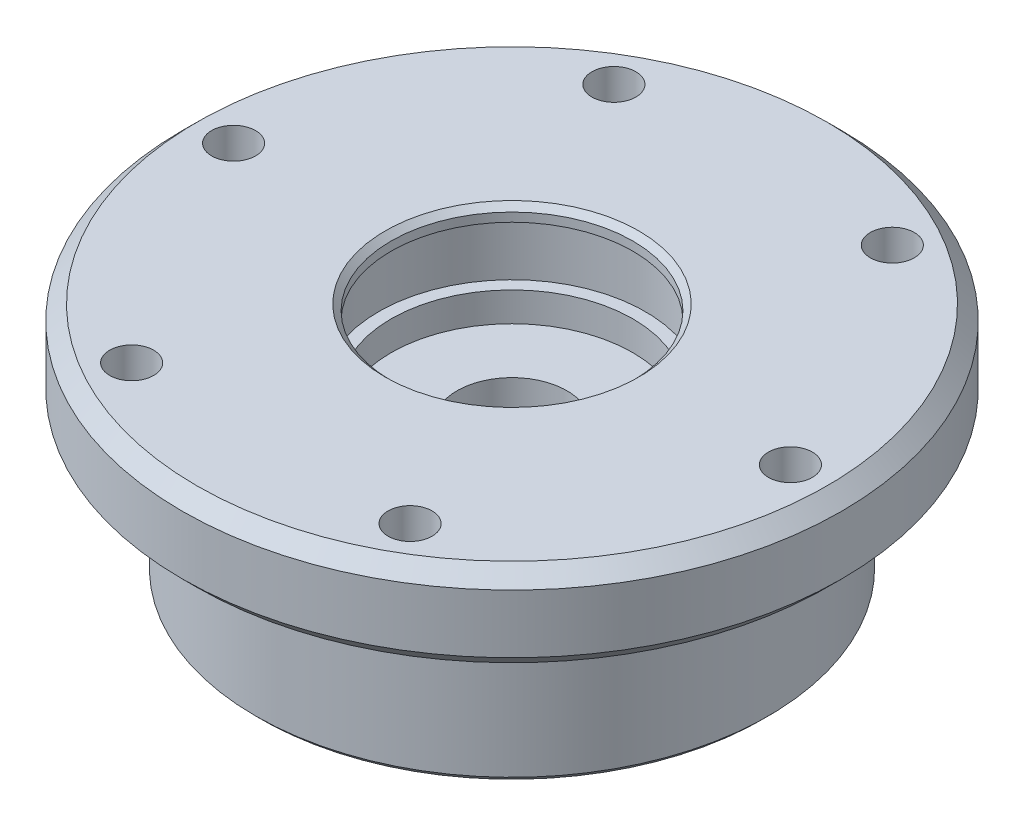
from build123d import *

# Parameters (mm, degrees)
SKETCH1_R           = 22.5
SKETCH1_R_2         = 1.5
SKETCH1_R_3         = 8.25
BOSS_EXTRUDE1_DEPTH = 3
SKETCH2_R           = 9.1
CUT_EXTRUDE1_DEPTH  = 2
SKETCH3_R           = 20.5
SKETCH3_R_2         = 17.5
BOSS_EXTRUDE2_DEPTH = 1
SKETCH4_R           = 17.5
SKETCH4_R_2         = 3.75
BOSS_EXTRUDE3_DEPTH = 10
SKETCH5_R           = 19
SKETCH5_R_2         = 17.5
BOSS_EXTRUDE4_DEPTH = 0.5
CHAMFER1_SIZE       = 1
CHAMFER3_SIZE       = 0.4
SKETCH6_R           = 2.35
CUT_EXTRUDE2_DEPTH  = 4
SKETCH7_R           = 1.75
CUT_EXTRUDE3_DEPTH  = 8
CHAMFER4_SIZE       = 0.4
CUT_EXTRUDE4_START  = -1
SKETCH8_R           = 8.25
CUT_EXTRUDE4_DEPTH  = 1


with BuildPart() as part:
    # Sketch1 → Boss-Extrude1 (new, symmetric)
    with BuildSketch(Plane(origin=(0, 0, 0), x_dir=(1, 0, 0), z_dir=(0, 1, 0))):
        Circle(SKETCH1_R)
        with Locations((19, 0)):
            Circle(SKETCH1_R_2, mode=Mode.SUBTRACT)
        with Locations((9.5, -16.454482672)):
            Circle(SKETCH1_R_2, mode=Mode.SUBTRACT)
        with Locations((-9.5, -16.454482672)):
            Circle(SKETCH1_R_2, mode=Mode.SUBTRACT)
        with Locations((-19, 0)):
            Circle(SKETCH1_R_2, mode=Mode.SUBTRACT)
        with Locations((-9.5, 16.454482672)):
            Circle(SKETCH1_R_2, mode=Mode.SUBTRACT)
        with Locations((9.5, 16.454482672)):
            Circle(SKETCH1_R_2, mode=Mode.SUBTRACT)
        Circle(SKETCH1_R_3, mode=Mode.SUBTRACT)
    extrude(amount=BOSS_EXTRUDE1_DEPTH, both=True)

    # Sketch2 → Cut-Extrude1 (cut, symmetric)
    with BuildSketch(Plane(origin=(0, 0, 0), x_dir=(1, 0, 0), z_dir=(0, 1, 0))):
        Circle(SKETCH2_R)
    extrude(amount=CUT_EXTRUDE1_DEPTH, both=True, mode=Mode.SUBTRACT)

    # Sketch3 → Boss-Extrude2 (add)
    with BuildSketch(Plane(origin=(0, -3, 0), x_dir=(1, 0, 0), z_dir=(0, 1, 0))):
        Circle(SKETCH3_R)
        Circle(SKETCH3_R_2, mode=Mode.SUBTRACT)
    extrude(amount=BOSS_EXTRUDE2_DEPTH)

    # Sketch4 → Boss-Extrude3 (add)
    with BuildSketch(Plane.XZ.offset(3)):
        Circle(SKETCH4_R)
        Circle(SKETCH4_R_2, mode=Mode.SUBTRACT)
    extrude(amount=BOSS_EXTRUDE3_DEPTH)

    # Sketch5 → Boss-Extrude4 (add)
    with BuildSketch(Plane.XZ.offset(3)):
        Circle(SKETCH5_R)
        Circle(SKETCH5_R_2, mode=Mode.SUBTRACT)
    extrude(amount=BOSS_EXTRUDE4_DEPTH)

    # Chamfer1
    chamfer1_edges = [part.edges().sort_by_distance(p)[0] for p in [
        (-22.5, -3, 0),
        (-22.5, 3, 0),
    ]]
    chamfer(chamfer1_edges, length=CHAMFER1_SIZE)

    # Chamfer3
    chamfer3_edges = [part.edges().sort_by_distance(p)[0] for p in [
        (-8.25, 3, 0),
    ]]
    chamfer(chamfer3_edges, length=CHAMFER3_SIZE)

    # Sketch6 → Cut-Extrude2 (cut)
    with BuildSketch(Plane.XZ.offset(13)):
        with Locations((7.5, 0)):
            Circle(SKETCH6_R)
        with Locations((0, 7.5)):
            Circle(SKETCH6_R)
        with Locations((-7.5, 0)):
            Circle(SKETCH6_R)
        with Locations((0, -7.5)):
            Circle(SKETCH6_R)
    extrude(amount=-CUT_EXTRUDE2_DEPTH, mode=Mode.SUBTRACT)

    # Sketch7 → Cut-Extrude3 (cut)
    with BuildSketch(Plane.XZ.offset(13)):
        with Locations((0, 7.5)):
            Circle(SKETCH7_R)
        with Locations((7.5, 0)):
            Circle(SKETCH7_R)
        with Locations((0, -7.5)):
            Circle(SKETCH7_R)
        with Locations((-7.5, 0)):
            Circle(SKETCH7_R)
    extrude(amount=-CUT_EXTRUDE3_DEPTH, mode=Mode.SUBTRACT)

    # Chamfer4
    chamfer4_edges = [part.edges().sort_by_distance(p)[0] for p in [
        (-17.5, -13, 0),
    ]]
    chamfer(chamfer4_edges, length=CHAMFER4_SIZE)

    # Sketch8 → Cut-Extrude4 (cut)
    with BuildSketch(Plane(origin=(0, -3, 0), x_dir=(1, 0, 0), z_dir=(0, 1, 0)).offset(CUT_EXTRUDE4_START)):
        Circle(SKETCH8_R)
    extrude(amount=CUT_EXTRUDE4_DEPTH, mode=Mode.SUBTRACT)


solid = part.part
